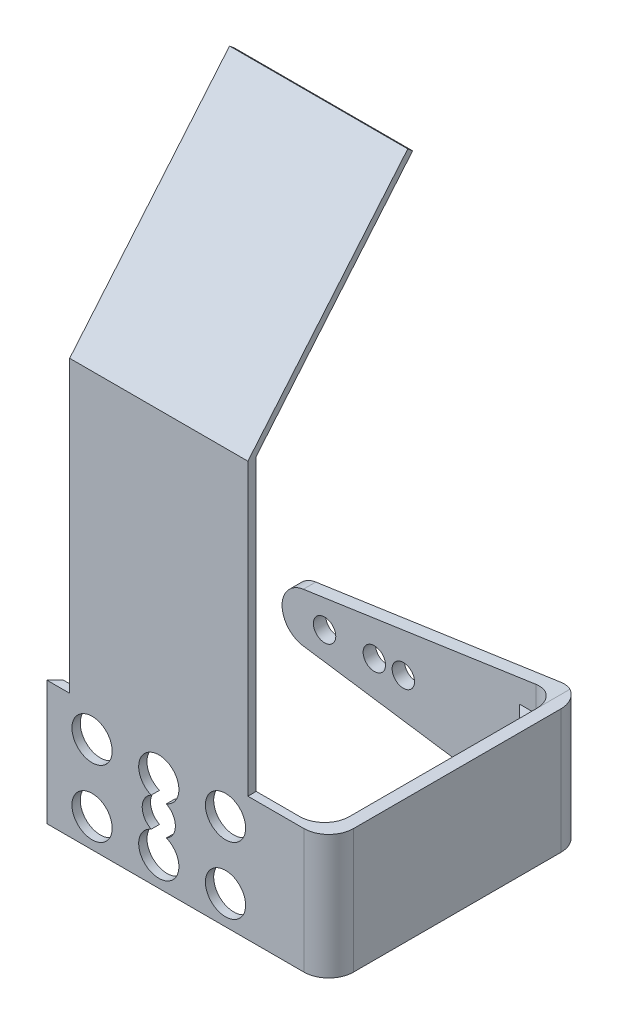
from build123d import *

# Parameters (mm, degrees)
SKETCH_1_W          = 27
SKETCH_1_H          = 15
EXTRUDE_1_DEPTH     = 1
SKETCH_2_R          = 2.425
CUT_EXTRUDE_1_DEPTH = 16.475787541
EXTRUDE_2_DEPTH     = 15
SKETCH_6_W          = 1.5
SKETCH_6_H          = 2
EXTRUDE_3_DEPTH     = 4
CHAMFER_1_SIZE      = 1
CUT_EXTRUDE_4_REACH = 39.101
SKETCH_8_R          = 2
SKETCH_9_W          = 21.5
SKETCH_9_H          = 35
EXTRUDE_4_DEPTH     = 1
SKETCH_7_R          = 1.35
CUT_EXTRUDE_5_DEPTH = 10
SKETCH_12_W         = 12.5
SKETCH_12_H         = 15
EXTRUDE_5_DEPTH     = 1.5
SKETCH_13_R         = 1.35
CUT_EXTRUDE_6_DEPTH = 10
CUT_EXTRUDE_7_DEPTH = 10
FILLET_1_R          = 3
SKETCH_16_W         = 21.5
SKETCH_16_H         = 30
EXTRUDE_6_DEPTH     = 0.766044


with BuildPart() as part:
    # 草图1 → 凸台-拉伸1 (new body)
    with BuildSketch(Plane.XY):
        Rectangle(SKETCH_1_W, SKETCH_1_H)
    extrude(amount=EXTRUDE_1_DEPTH)

    # 草图2 → 切除-拉伸1 (cut, through all)
    with BuildSketch(Plane.XY.offset(1)):
        with Locations((0, 4.025)):
            Circle(SKETCH_2_R)
        with Locations((0, -4.025)):
            Circle(SKETCH_2_R)
        with Locations((8.05, 4.025)):
            Circle(SKETCH_2_R)
        with Locations((8.05, -4.025)):
            Circle(SKETCH_2_R)
        with Locations((-8.05, 4.025)):
            Circle(SKETCH_2_R)
        with Locations((-8.05, -4.025)):
            Circle(SKETCH_2_R)
    extrude(amount=-CUT_EXTRUDE_1_DEPTH, mode=Mode.SUBTRACT)

    # 草图3 → 凸台-拉伸2 (add)
    with BuildSketch(Plane.XZ.offset(7.5)):
        Polygon((13.5, 0), (19, 0), (19, -28.5), (-4.5, -28.5), (-4.5, -30), (20.5, -30), (20.5, 1), (13.5, 1), align=None)
    extrude(amount=-EXTRUDE_2_DEPTH)

    # 草图6 → 凸台-拉伸3 (add, symmetric)
    with BuildSketch(Plane(origin=(0, 0, 0), x_dir=(1, 0, 0), z_dir=(0, 1, 0))):
        Polygon((19, 0), (19, 5), (14, 0), align=None)
        Polygon((19, 28.5), (14, 28.5), (19, 23.5), align=None)
        with Locations((18.25, 20)):
            Rectangle(SKETCH_6_W, SKETCH_6_H)
    extrude(amount=EXTRUDE_3_DEPTH, both=True)

    # 倒角1
    chamfer_1_edges = [part.edges().sort_by_distance(p)[0] for p in [
        (-13.5, 0, 0),
    ]]
    chamfer(chamfer_1_edges, length=CHAMFER_1_SIZE - 0.0001)  # a hair under: the kernel refuses the full size

    # 草图8 → 切除-拉伸4 (cut, up to next)
    with BuildSketch(Plane(origin=(0, 0, 0), x_dir=(-1, 0, 0), z_dir=(0, 0, -1)), mode=Mode.PRIVATE) as cut_extrude_4_sk1:
        Circle(SKETCH_8_R)
    cut_extrude_4_tool1 = extrude(cut_extrude_4_sk1.sketch, amount=-CUT_EXTRUDE_4_REACH, mode=Mode.PRIVATE) & part.part
    add(cut_extrude_4_tool1.solids().sort_by_distance((0, 0, 0))[0], mode=Mode.SUBTRACT)

    # 草图9 → 凸台-拉伸4 (add)
    with BuildSketch(Plane.XY.offset(1)):
        with Locations((0, 25)):
            Rectangle(SKETCH_9_W, SKETCH_9_H)
    extrude(amount=-EXTRUDE_4_DEPTH)

    # 草图7 → 切除-拉伸5 (cut)
    with BuildSketch(Plane(origin=(0, 0, -30), x_dir=(-1, 0, 0), z_dir=(0, 0, -1))):
        Circle(SKETCH_7_R)
    extrude(amount=-CUT_EXTRUDE_5_DEPTH, mode=Mode.SUBTRACT)

    # 草图12 → 凸台-拉伸5 (add)
    with BuildSketch(Plane(origin=(0, 0, -30), x_dir=(-1, 0, 0), z_dir=(0, 0, -1))):
        with Locations((10.75, 0)):
            Rectangle(SKETCH_12_W, SKETCH_12_H)
    extrude(amount=-EXTRUDE_5_DEPTH)

    # 草图13 → 切除-拉伸6 (cut)
    with BuildSketch(Plane(origin=(0, 0, -30), x_dir=(-1, 0, 0), z_dir=(0, 0, -1))):
        with Locations((3.5, 0)):
            Circle(SKETCH_13_R)
        with Locations((9.5, 0)):
            Circle(SKETCH_13_R)
    extrude(amount=-CUT_EXTRUDE_6_DEPTH, mode=Mode.SUBTRACT)

    # 草图14 → 切除-拉伸7 (cut)
    with BuildSketch(Plane(origin=(0, 0, -30), x_dir=(-1, 0, 0), z_dir=(0, 0, -1))):
        with BuildLine():
            Line((-19, 7.5), (12.061111893, 2.968576032))
            ThreePointArc((12.061111893, 2.968576032), (14.627429927, -0.060207147), (11.941634037, -2.983564161))
            Line((11.941634037, -2.983564161), (-19, -7.5))
            Line((-19, -7.5), (17, -7.5))
            Line((17, -7.5), (17, 7.5))
            Line((17, 7.5), (-19, 7.5))
        make_face()
    extrude(amount=-CUT_EXTRUDE_7_DEPTH, mode=Mode.SUBTRACT)

    # 圆角1
    fillet_1_edges = [part.edges().sort_by_distance(p)[0] for p in [
        (20.5, 0, -30),
        (20.5, 0, 1),
        (19, 5.75, 0),
        (19, -5.75, 0),
        (19, 5.75, -28.5),
        (19, -5.75, -28.5),
    ]]
    fillet(fillet_1_edges, radius=FILLET_1_R)

    # 草图16 → 凸台-拉伸6 (add)
    with BuildSketch(Plane(origin=(0, 18.052380101, 21.51398884), x_dir=(-1, 0, 0), z_dir=(0, 0.6427876096865406, 0.7660444431189771))):
        with Locations((0, -46.914101223)):
            Rectangle(SKETCH_16_W, SKETCH_16_H)
    extrude(amount=-EXTRUDE_6_DEPTH)


solid = part.part
